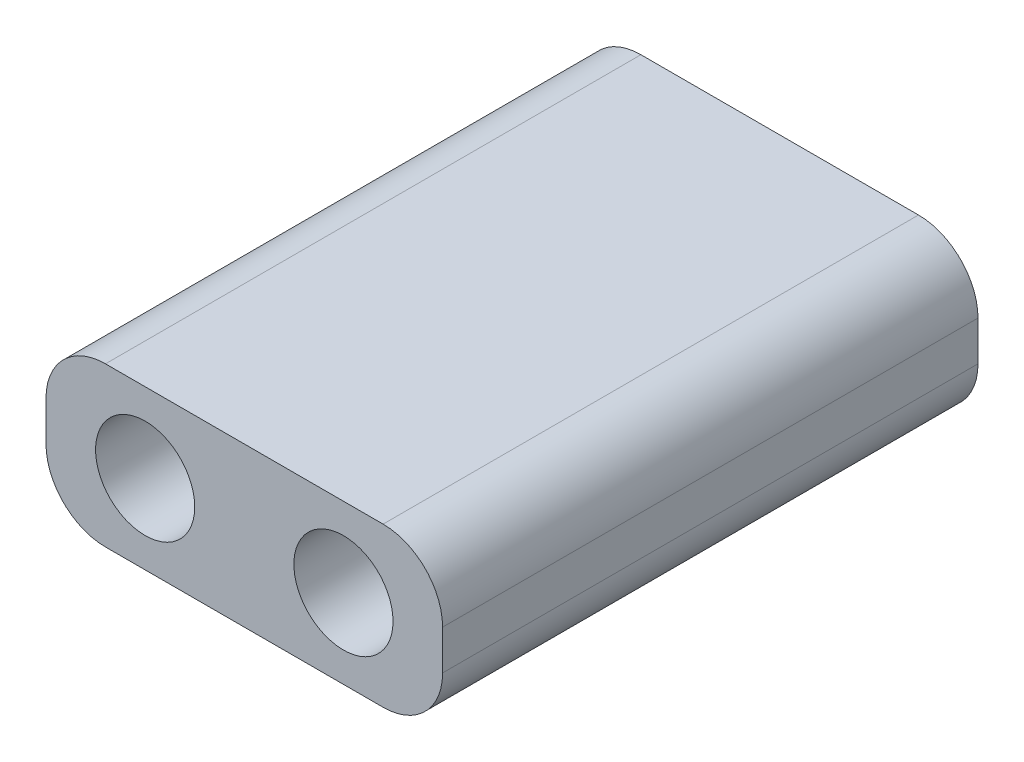
from build123d import *

# Parameters (mm, degrees)
SKETCH2_W           = 20
SKETCH2_H           = 8
BOSS_EXTRUDE1_DEPTH = 27
SKETCH3_R           = 2.5
CUT_EXTRUDE1_DEPTH  = 34
FILLET1_R           = 3


with BuildPart() as part:
    # Sketch2 → Boss-Extrude1 (new body)
    with BuildSketch(Plane.XY):
        Rectangle(SKETCH2_W, SKETCH2_H)
    extrude(amount=BOSS_EXTRUDE1_DEPTH)

    # Sketch3 → Cut-Extrude1 (cut)
    with BuildSketch(Plane.XY.offset(27)):
        with Locations((-5, 0)):
            Circle(SKETCH3_R)
        with Locations((5, 0)):
            Circle(SKETCH3_R)
    extrude(amount=-CUT_EXTRUDE1_DEPTH, mode=Mode.SUBTRACT)

    # Fillet1
    fillet1_edges = [part.edges().sort_by_distance(p)[0] for p in [
        (10, -4, 13.5),
        (10, 4, 13.5),
        (-10, -4, 13.5),
        (-10, 4, 13.5),
    ]]
    fillet(fillet1_edges, radius=FILLET1_R)


solid = part.part
